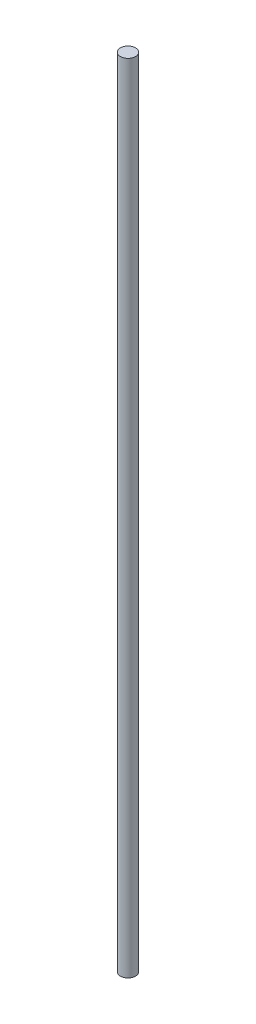
from build123d import *

# Parameters (mm, degrees)
SKETCH1_R           = 2
BOSS_EXTRUDE1_DEPTH = 210


with BuildPart() as part:
    # Sketch1 → Boss-Extrude1 (new body)
    with BuildSketch(Plane(origin=(0, 0, 0), x_dir=(1, 0, 0), z_dir=(0, 1, 0))):
        with Locations((-20.440122927, 20.57602509)):
            Circle(SKETCH1_R)
    extrude(amount=BOSS_EXTRUDE1_DEPTH)


solid = part.part
